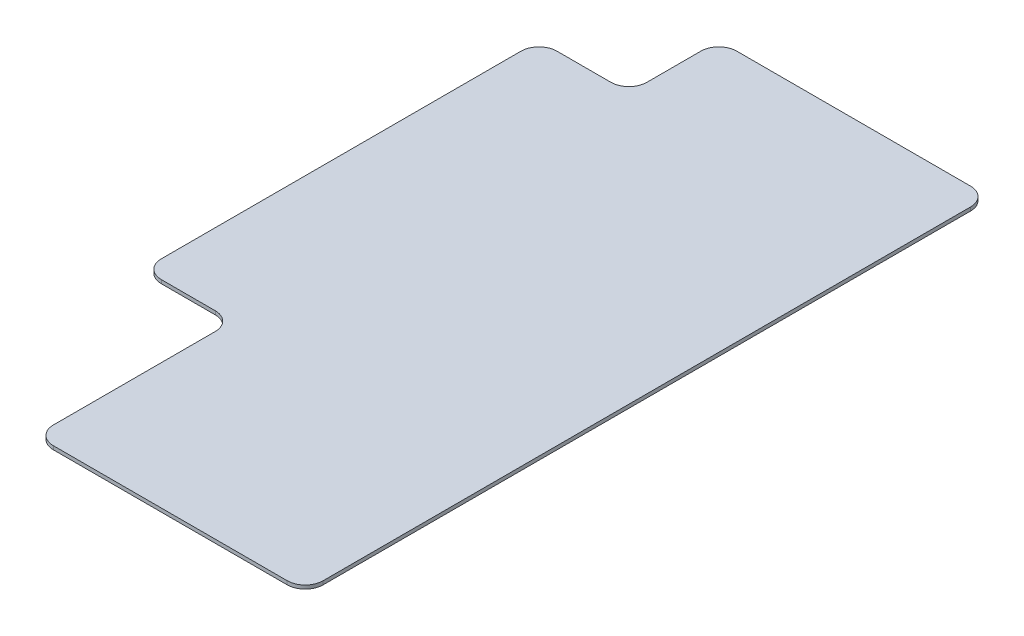
from build123d import *

# Parameters (mm, degrees)
BOSS_EXTRUDE1_DEPTH = 10


with BuildPart() as part:
    # Sketch2 → Boss-Extrude1 (new body)
    with BuildSketch(Plane(origin=(0, 0, 0), x_dir=(1, 0, 0), z_dir=(0, 1, 0))):
        with BuildLine():
            Line((-1000, 1600), (-1000, 600))
            ThreePointArc((-1000, 600), (-985.355339059, 564.644660941), (-950, 550))
            Line((-950, 550), (-800, 550))
            ThreePointArc((-800, 550), (-764.644660941, 535.355339059), (-750, 500))
            Line((-750, 500), (-750, 50))
            ThreePointArc((-750, 50), (-735.355339059, 14.644660941), (-700, 0))
            Line((-700, 0), (-50, 0))
            ThreePointArc((-50, 0), (-14.644660941, 14.644660941), (0, 50))
            Line((0, 50), (0, 1850))
            ThreePointArc((0, 1850), (-14.644660941, 1885.355339059), (-50, 1900))
            Line((-50, 1900), (-700, 1900))
            ThreePointArc((-700, 1900), (-735.355339059, 1885.355339059), (-750, 1850))
            Line((-750, 1850), (-750, 1700))
            ThreePointArc((-750, 1700), (-764.644660941, 1664.644660941), (-800, 1650))
            Line((-800, 1650), (-950, 1650))
            ThreePointArc((-950, 1650), (-985.355339059, 1635.355339059), (-1000, 1600))
        make_face()
    extrude(amount=BOSS_EXTRUDE1_DEPTH)


solid = part.part
